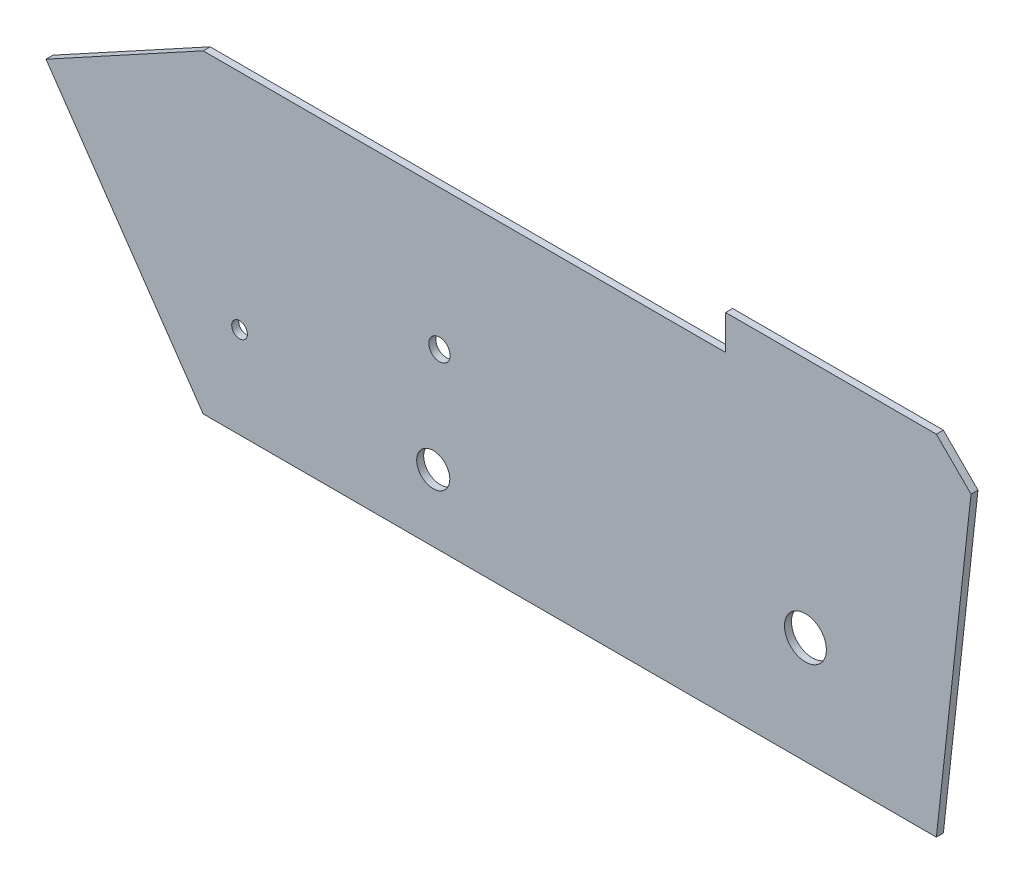
from build123d import *

# Parameters (mm, degrees)
BOSS_EXTRUDE1_DEPTH = 2
SKETCH2_R           = 6
CUT_EXTRUDE1_DEPTH  = 10
SKETCH3_R           = 3.05
CUT_EXTRUDE2_DEPTH  = 10
SKETCH4_R           = 2.250300441
CUT_EXTRUDE3_DEPTH  = 10
SKETCH5_R           = 4.740417633
CUT_EXTRUDE4_DEPTH  = 10


with BuildPart() as part:
    # Sketch1 → Boss-Extrude1 (new body)
    with BuildSketch(Plane.XY):
        Polygon((192.039285274, 88.983833718), (201.963048499, 79.060070494), (192.039285274, -11.016166282), (-18.008037477, -11.016166282), (-63.036951501, 54.472600305), (-18.008037477, 79.060070494), (131.67120814, 79.060070494), (131.67120814, 88.983833718), align=None)
    extrude(amount=BOSS_EXTRUDE1_DEPTH)

    # Sketch2 → Cut-Extrude1 (cut)
    with BuildSketch(Plane.XY.offset(2)):
        with Locations((154.523318399, 19.695137593)):
            Circle(SKETCH2_R)
    extrude(amount=-CUT_EXTRUDE1_DEPTH, mode=Mode.SUBTRACT)

    # Sketch3 → Cut-Extrude2 (cut)
    with BuildSketch(Plane.XY.offset(2)):
        with Locations((49.67998792, 38.825070368)):
            Circle(SKETCH3_R)
    extrude(amount=-CUT_EXTRUDE2_DEPTH, mode=Mode.SUBTRACT)

    # Sketch4 → Cut-Extrude3 (cut)
    with BuildSketch(Plane.XY.offset(2)):
        with Locations((-7.586199085, 15.078509139)):
            Circle(SKETCH4_R)
    extrude(amount=-CUT_EXTRUDE3_DEPTH, mode=Mode.SUBTRACT)

    # Sketch5 → Cut-Extrude4 (cut)
    with BuildSketch(Plane.XY.offset(2)):
        with Locations((47.903695827, 8.119584274)):
            Circle(SKETCH5_R)
    extrude(amount=-CUT_EXTRUDE4_DEPTH, mode=Mode.SUBTRACT)


solid = part.part
